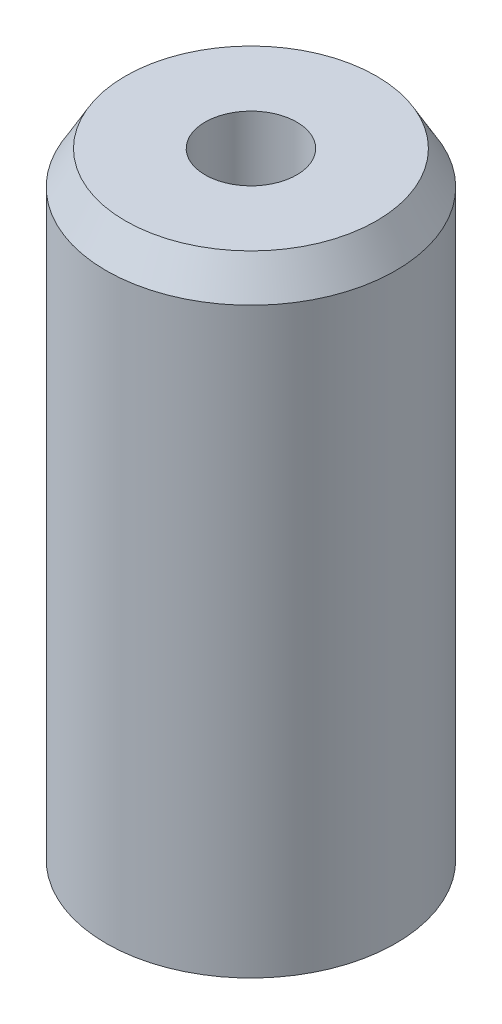
from build123d import *
from OCP.BRepFilletAPI import BRepFilletAPI_MakeChamfer

# Parameters (mm, degrees)
SKETCH1_R           = 20
BOSS_EXTRUDE1_DEPTH = 87.757777283
SKETCH2_R           = 6.328997623
CUT_EXTRUDE1_DEPTH  = 93.203185811
CHAMFER1_SIZE       = 4.615228755
CHAMFER1_SIZE2      = 2.664603564


with BuildPart() as part:
    # Sketch1 → Boss-Extrude1 (new body)
    with BuildSketch(Plane(origin=(0, 0, 0), x_dir=(1, 0, 0), z_dir=(0, 1, 0))):
        Circle(SKETCH1_R)
    extrude(amount=BOSS_EXTRUDE1_DEPTH)

    # Sketch2 → Cut-Extrude1 (cut, through all)
    with BuildSketch(Plane(origin=(0, 0, 0), x_dir=(1, 0, 0), z_dir=(0, 1, 0))):
        Circle(SKETCH2_R)
    extrude(amount=CUT_EXTRUDE1_DEPTH, mode=Mode.SUBTRACT)

    # Chamfer1: one chamfer whose edges measure the first distance from different faces: ONE call of the kernel's chamfer builder (chamfer() names one face for all edges)
    chamfer1_edges_1 = [part.edges().sort_by_distance(p)[0] for p in [
        (-20, 87.757777283, 0),
    ]]
    chamfer1_side_1 = [part.faces().sort_by_distance(p)[0] for p in [
        (-20, 43.878888642, 0),
    ]]
    chamfer1_edges_2 = [part.edges().sort_by_distance(p)[0] for p in [
        (-20, 0, 0),
    ]]
    chamfer1_side_2 = [part.faces().sort_by_distance(p)[0] for p in [
        (-19.434314575, 0, 0),
    ]]
    chamfer1 = BRepFilletAPI_MakeChamfer(part.part.solid().wrapped)
    for e in chamfer1_edges_1:
        chamfer1.Add(CHAMFER1_SIZE, CHAMFER1_SIZE2, e.wrapped, chamfer1_side_1[0].wrapped)  # the first distance lies on this face
    for e in chamfer1_edges_2:
        chamfer1.Add(CHAMFER1_SIZE, CHAMFER1_SIZE2, e.wrapped, chamfer1_side_2[0].wrapped)  # the first distance lies on this face
    add(Compound.cast(chamfer1.Shape()), mode=Mode.REPLACE)


solid = part.part
